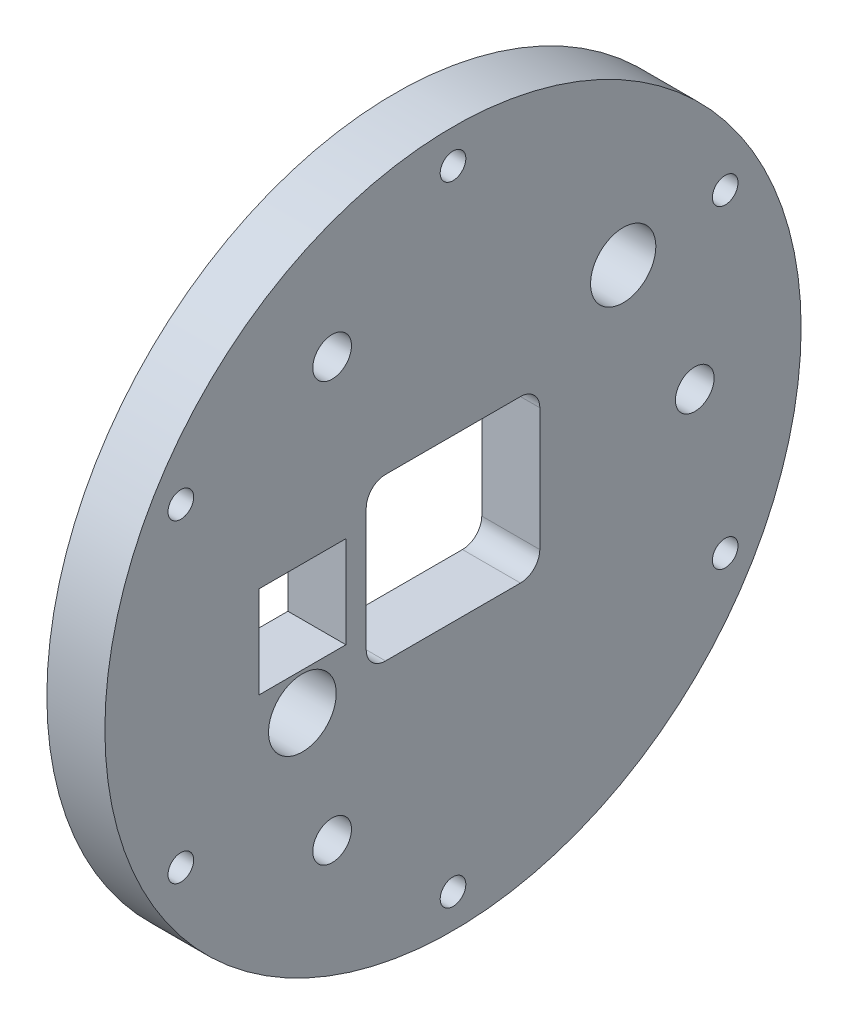
from build123d import *

# Parameters (mm, degrees)
SKETCH4_R           = 72
BOSS_EXTRUDE3_DEPTH = 12
SKETCH3_R           = 4
CUT_EXTRUDE6_DEPTH  = 103.528044944
SKETCH2_R           = 2.65
CUT_EXTRUDE1_DEPTH  = 103.528044944
SKETCH1_R           = 7
SKETCH1_W           = 18
SKETCH1_H           = 19
GOPRO_DEPTH         = 103.528044944
D_GAGEMENT_M121_D   = 13.5


with BuildPart() as part:
    # Sketch4 → Boss-Extrude3 (new body)
    with BuildSketch(Plane(origin=(0, 0, 0), x_dir=(0, 0, -1), z_dir=(1, 0, 0))):
        Circle(SKETCH4_R)
    extrude(amount=BOSS_EXTRUDE3_DEPTH)

    # Sketch3 → Cut-Extrude6 (cut, through all)
    with BuildSketch(Plane(origin=(0, 0, 0), x_dir=(0, 0, -1), z_dir=(1, 0, 0))):
        with Locations((50, 0)):
            Circle(SKETCH3_R)
        with Locations((-25, -43.301270189)):
            Circle(SKETCH3_R)
        with Locations((-25, 43.301270189)):
            Circle(SKETCH3_R)
    extrude(amount=CUT_EXTRUDE6_DEPTH, mode=Mode.SUBTRACT)

    # Sketch2 → Cut-Extrude1 (cut, through all)
    with BuildSketch(Plane(origin=(0, 0, 0), x_dir=(0, 0, -1), z_dir=(1, 0, 0))):
        with Locations((0, 65)):
            Circle(SKETCH2_R)
        with Locations((56.291651246, 32.5)):
            Circle(SKETCH2_R)
        with Locations((56.291651246, -32.5)):
            Circle(SKETCH2_R)
        with Locations((0, -65)):
            Circle(SKETCH2_R)
        with Locations((-56.291651246, -32.5)):
            Circle(SKETCH2_R)
        with Locations((-56.291651246, 32.5)):
            Circle(SKETCH2_R)
    extrude(amount=CUT_EXTRUDE1_DEPTH, mode=Mode.SUBTRACT)

    # Sketch1 → gopro (cut, through all)
    with BuildSketch(Plane(origin=(0, 0, 0), x_dir=(0, 0, -1), z_dir=(1, 0, 0))):
        with Locations((-31.15, -17.4)):
            Circle(SKETCH1_R)
        with BuildLine():
            Line((-13.95, 16.7), (13.95, 16.7))
            ThreePointArc((13.95, 16.7), (16.778427125, 15.528427125), (17.95, 12.7))
            Line((17.95, 12.7), (17.95, -12.7))
            ThreePointArc((17.95, -12.7), (16.778427125, -15.528427125), (13.95, -16.7))
            Line((13.95, -16.7), (-13.95, -16.7))
            ThreePointArc((-13.95, -16.7), (-16.778427125, -15.528427125), (-17.95, -12.7))
            Line((-17.95, -12.7), (-17.95, 12.7))
            ThreePointArc((-17.95, 12.7), (-16.778427125, 15.528427125), (-13.95, 16.7))
        make_face()
        with Locations((-31.15, -0.2)):
            Rectangle(SKETCH1_W, SKETCH1_H)
    extrude(amount=GOPRO_DEPTH, mode=Mode.SUBTRACT)

    # Dégagement M121 (through all)
    with Locations(Plane(origin=(12, 0, 0), x_dir=(0, 0, -1), z_dir=(1, 0, 0))):
        with Locations((35.198275853, 29.615559711)):
            Hole(D_GAGEMENT_M121_D / 2)


solid = part.part
